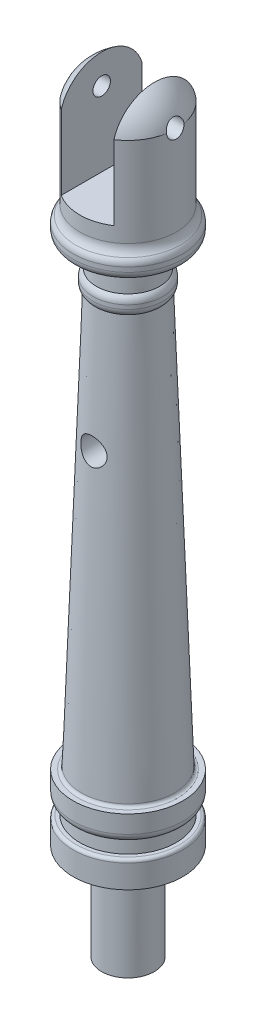
from build123d import *

# Parameters (mm, degrees)
SKETCH2_R               = 12.5
BOSS_EXTRUDE1_DEPTH     = 6
BOSS_EXTRUDE2_START     = -12
SKETCH3_R               = 12.5
BOSS_EXTRUDE2_DEPTH     = 3
FILLET1_R               = 2
FILLET2_R               = 0.7
SKETCH4_R               = 6
BOSS_EXTRUDE3_DEPTH     = 22
CUT_EXTRUDE1_START      = -15
CUT_EXTRUDE1_DEPTH      = 15
BOSS_EXTRUDE4_START     = -8
SKETCH6_R               = 8
BOSS_EXTRUDE4_DEPTH     = 2
FILLET3_R               = 2
SKETCH7_R               = 12.5
BOSS_EXTRUDE5_DEPTH     = 5
SKETCH8_R               = 11
BOSS_EXTRUDE6_DEPTH     = 22
FILLET4_R               = 2
FILLET5_R               = 3
FILLET6_R               = 0.7
CUT_EXTRUDE2_DEPTH      = 151.331862616
CUT_EXTRUDE2_DEPTH_BACK = 151.331862616
SKETCH10_W              = 12
SKETCH10_H              = 28
CUT_EXTRUDE3_DEPTH      = 149.77455171
CUT_EXTRUDE3_DEPTH_BACK = 149.77455171
SKETCH11_R              = 3
CUT_EXTRUDE4_DEPTH      = 149.77455171
CUT_EXTRUDE4_DEPTH_BACK = 149.77455171
SKETCH12_R              = 2


with BuildPart() as part:
    # Sketch1 → Revolve1 (revolve)
    with BuildSketch(Plane.XY, mode=Mode.PRIVATE) as revolve1_sk:
        Polygon((0, 0), (0, 114), (7, 114), (11, 0), align=None)
    revolve(revolve1_sk.sketch.rotate(Axis((0, 0, 0), (0, 1, 0)), 90), axis=Axis((0, 0, 0), (0, 1, 0)))

    # Sketch2 → Boss-Extrude1 (add)
    with BuildSketch(Plane.XZ):
        with Locations(Location((0, 0, 0), (0, 0, 270))):
            Circle(SKETCH2_R)
    extrude(amount=BOSS_EXTRUDE1_DEPTH)

    # Sketch3 → Boss-Extrude2 (add, symmetric)
    with BuildSketch(Plane.XZ.offset(6).offset(BOSS_EXTRUDE2_START)):
        with Locations(Location((0, 0, 0), (0, 0, 270))):
            Circle(SKETCH3_R)
    extrude(amount=BOSS_EXTRUDE2_DEPTH, both=True)

    # Fillet1
    # the kernel refuses this fillet: 2 mm, written as the material it takes off along each edge
    with BuildSketch(Plane(origin=(0, 3, 0), x_dir=(0, 0, -1), z_dir=(-1, 0, 0))) as fillet1_piece_1:
        with BuildLine():
            CenterArc((10.5, -1.960658773), FILLET1_R, 0, 78.616886518)
            Line((12.5, -1.960658773), (12.54, -1.960658773))
            Line((12.54, -1.960658773), (12.54, 0))
            Line((12.54, 0), (12.5, 0.04))
            ThreePointArc((12.5, 0.04), (11.697368421, 0.04), (10.902631579, 0.039213175))
            Line((10.902631579, 0.039213175), (10.894736842, 0))
        make_face()
    revolve(axis=Axis((0, 3, 0), (0, -1, 0)), mode=Mode.SUBTRACT)

    # Fillet2
    fillet2_edges = [part.edges().sort_by_distance(p)[0] for p in [
        (0, 0, 12.5),
    ]]
    fillet(fillet2_edges, radius=FILLET2_R)

    # Sketch4 → Boss-Extrude3 (add)
    with BuildSketch(Plane.XZ.offset(6)):
        with Locations(Location((0, 0, 0), (0, 0, 270))):
            Circle(SKETCH4_R)
    extrude(amount=BOSS_EXTRUDE3_DEPTH)

    # Sketch5 → Cut-Extrude1 (cut)
    with BuildSketch(Plane(origin=(0, -28, 0), x_dir=(-1, 0, 0), z_dir=(0, -1, 0)).offset(CUT_EXTRUDE1_START)):
        with BuildLine():
            Line((5, -3.31662479), (5, 3.31662479))
            ThreePointArc((5, 3.31662479), (6, 0), (5, -3.31662479))
        make_face()
    extrude(amount=CUT_EXTRUDE1_DEPTH, mode=Mode.SUBTRACT)

    # Sketch6 → Boss-Extrude4 (add, symmetric)
    with BuildSketch(Plane(origin=(0, 114, 0), x_dir=(1, 0, 0), z_dir=(0, 1, 0)).offset(BOSS_EXTRUDE4_START)):
        with Locations(Location((0, 0, 0), (0, 0, 270))):
            Circle(SKETCH6_R)
    extrude(amount=BOSS_EXTRUDE4_DEPTH, both=True)

    # Fillet3
    # the kernel refuses this fillet: 2 mm, written as the material it takes off along each edge
    with BuildSketch(Plane(origin=(0, 104, 0), x_dir=(0, 0, 1), z_dir=(-1, 0, 0))) as fillet3_piece_1:
        with BuildLine():
            CenterArc((6, 1.474832468), FILLET3_R, 312.488219007, 47.511780993)
            Line((8, 1.474832468), (8.04, 1.474832468))
            Line((8.04, 1.474832468), (8.04, 0))
            Line((8.04, 0), (8, -0.04))
            ThreePointArc((8, -0.04), (7.675438596, -0.04), (7.377894737, -0.029496649))
            Line((7.377894737, -0.029496649), (7.350877193, 0))
        make_face()
    revolve(axis=Axis((0, 104, 0), (0, 1, 0)), mode=Mode.SUBTRACT)
    with BuildSketch(Plane(origin=(0, 108, 0), x_dir=(0, 0, 1), z_dir=(-1, 0, 0))) as fillet3_piece_2:
        with BuildLine():
            CenterArc((6, -1.592050891), FILLET3_R, 0, 52.752219104)
            Line((7.210526316, 0), (7.234736842, 0.031841018))
            ThreePointArc((7.234736842, 0.031841018), (7.605263158, 0.04), (8, 0.04))
            Line((8, 0.04), (8.04, 0))
            Line((8.04, 0), (8.04, -1.592050891))
            Line((8.04, -1.592050891), (8, -1.592050891))
        make_face()
    revolve(axis=Axis((0, 108, 0), (0, 1, 0)), mode=Mode.SUBTRACT)

    # Sketch7 → Boss-Extrude5 (add)
    with BuildSketch(Plane(origin=(0, 114, 0), x_dir=(1, 0, 0), z_dir=(0, 1, 0))):
        with Locations(Location((0, 0, 0), (0, 0, 90))):
            Circle(SKETCH7_R)
    extrude(amount=BOSS_EXTRUDE5_DEPTH)

    # Sketch8 → Boss-Extrude6 (add)
    with BuildSketch(Plane(origin=(0, 119, 0), x_dir=(1, 0, 0), z_dir=(0, 1, 0))):
        with Locations(Location((0, 0, 0), (0, 0, 270))):
            Circle(SKETCH8_R)
    extrude(amount=BOSS_EXTRUDE6_DEPTH)

    # Fillet4
    # the kernel refuses this fillet: 2 mm, written as the material it takes off along each edge
    with BuildSketch(Plane(origin=(0, 114, 0), x_dir=(0, 0, -1), z_dir=(1, 0, 0))) as fillet4_piece_1:
        with BuildLine():
            CenterArc((12.5 - FILLET4_R, FILLET4_R), FILLET4_R, 270, 90)
            Line((12.5 - FILLET4_R, 0), (12.5 - FILLET4_R, -FILLET4_R * 0.02))
            Line((12.5 - FILLET4_R, -FILLET4_R * 0.02), (12.5 + FILLET4_R * 0.02, -FILLET4_R * 0.02))
            Line((12.5 + FILLET4_R * 0.02, -FILLET4_R * 0.02), (12.5 + FILLET4_R * 0.02, FILLET4_R))
            Line((12.5 + FILLET4_R * 0.02, FILLET4_R), (12.5, FILLET4_R))
        make_face()
    revolve(axis=Axis((0, 114, 0), (0, 1, 0)), mode=Mode.SUBTRACT)
    with BuildSketch(Plane(origin=(0, 119, 0), x_dir=(0, 0, -1), z_dir=(1, 0, 0))) as fillet4_piece_2:
        with BuildLine():
            CenterArc((10.5, -1.936491673), FILLET4_R, 0, 75.522487814)
            Line((11, 0), (11.01, 0.038729833))
            ThreePointArc((11.01, 0.038729833), (11.75, 0.04), (12.5, 0.04))
            Line((12.5, 0.04), (12.54, 0))
            Line((12.54, 0), (12.54, -1.936491673))
            Line((12.54, -1.936491673), (12.5, -1.936491673))
        make_face()
    revolve(axis=Axis((0, 119, 0), (0, 1, 0)), mode=Mode.SUBTRACT)

    # Fillet5
    fillet5_edges = [part.edges().sort_by_distance(p)[0] for p in [
        (-11, 119, 0),
    ]]
    fillet(fillet5_edges, radius=FILLET5_R)

    # Fillet6
    fillet6_edges = [part.edges().sort_by_distance(p)[0] for p in [
        (0, 9, 10.684210526),
    ]]
    fillet(fillet6_edges, radius=FILLET6_R)

    # Sketch9 → Revolve2 (revolve)
    with BuildSketch(Plane.XY, mode=Mode.PRIVATE) as revolve2_sk:
        with BuildLine():
            Line((11, 141), (0, 141))
            Line((0, 141), (0, 149.283642085))
            ThreePointArc((0, 149.283642085), (6.956520199, 147.075960883), (11, 141))
        make_face()
    revolve(revolve2_sk.sketch.rotate(Axis((0, 141, 0), (0, 1, 0)), 270), axis=Axis((0, 141, 0), (0, 1, 0)))

    # Sketch10 → Cut-Extrude2 (cut, two sides: drawn at the far end of the back side and taken through both)
    with BuildSketch(Plane.XY.offset(-CUT_EXTRUDE2_DEPTH_BACK)):
        with Locations((0, 138)):
            Rectangle(SKETCH10_W, SKETCH10_H)
    extrude(amount=CUT_EXTRUDE2_DEPTH + CUT_EXTRUDE2_DEPTH_BACK, mode=Mode.SUBTRACT)

    # Sketch11 → Cut-Extrude3 (cut, two sides: drawn at the far end of the back side and taken through both)
    with BuildSketch(Plane.XY.offset(-CUT_EXTRUDE3_DEPTH_BACK)):
        with Locations(Location((0, 76, 0), (0, 0, 270.000000038))):
            Circle(SKETCH11_R)
    extrude(amount=CUT_EXTRUDE3_DEPTH + CUT_EXTRUDE3_DEPTH_BACK, mode=Mode.SUBTRACT)

    # Sketch12 → Cut-Extrude4 (cut, two sides: drawn at the far end of the back side and taken through both)
    with BuildSketch(Plane(origin=(0, 0, 0), x_dir=(0, 0, -1), z_dir=(1, 0, 0)).offset(-CUT_EXTRUDE4_DEPTH_BACK)):
        with Locations((0, 141)):
            Circle(SKETCH12_R)
    extrude(amount=CUT_EXTRUDE4_DEPTH + CUT_EXTRUDE4_DEPTH_BACK, mode=Mode.SUBTRACT)


solid = part.part
